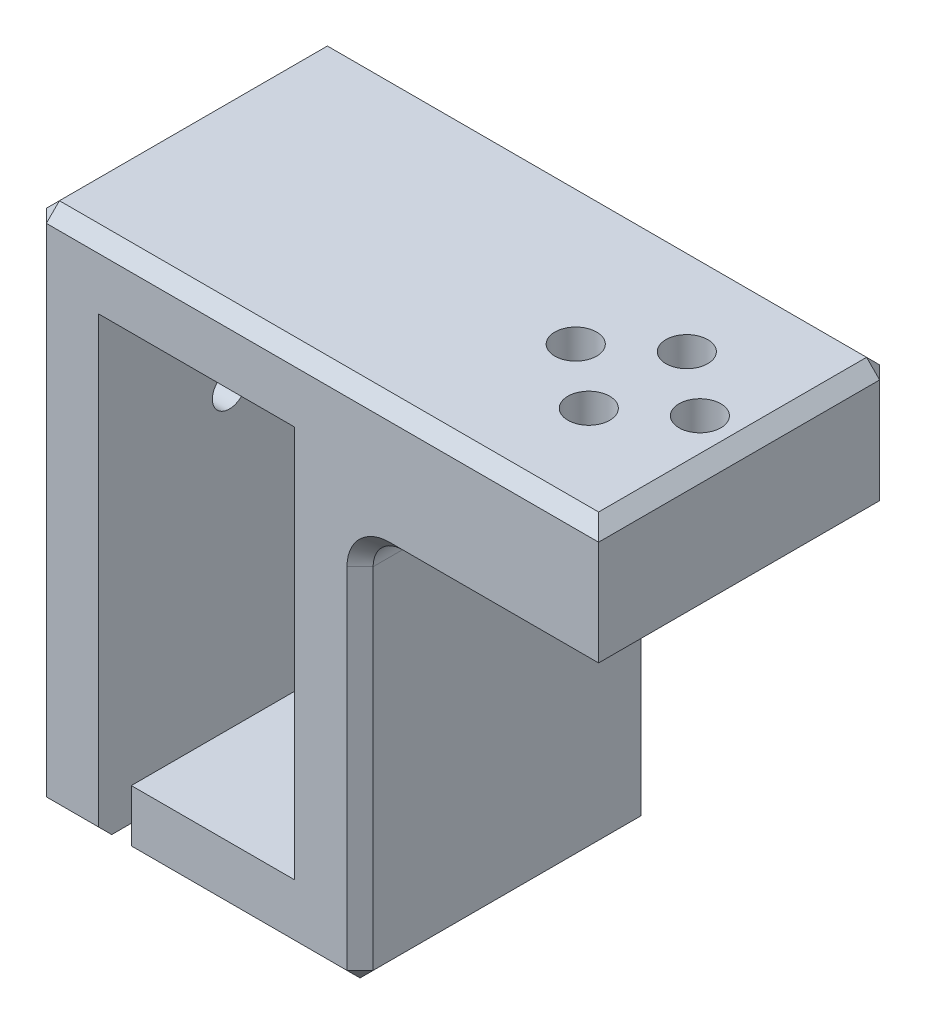
from build123d import *

# Parameters (mm, degrees)
BOSS_EXTRUDE1_DEPTH = 40
CUT_EXTRUDE1_START  = 10
SKETCH2_R           = 2.6
CUT_EXTRUDE1_DEPTH  = 113.46950766
SKETCH9_W           = 50
SKETCH9_H           = 80
BOSS_EXTRUDE2_DEPTH = 5
BOSS_EXTRUDE4_START = 80
SKETCH11_W          = 36.5
SKETCH11_H          = 45
SKETCH11_R          = 3.2
BOSS_EXTRUDE4_DEPTH = 20
CUT_EXTRUDE11_START = 60
SKETCH12_R          = 5.7
CUT_EXTRUDE11_DEPTH = 5
FILLET1_R           = 4.5


with BuildPart() as part:
    # Sketch1 → Boss-Extrude1 (new body)
    with BuildSketch(Plane.XY):
        Polygon((10, 0), (0, 0), (0, 80), (50, 80), (50, 0), (15, 0), (15, 10), (40, 10), (40, 70), (10, 70), align=None)
    extrude(amount=BOSS_EXTRUDE1_DEPTH)

    # Sketch2 → Cut-Extrude1 (cut, through all)
    with BuildSketch(Plane(origin=(0, 0, 0), x_dir=(0, 0, -1), z_dir=(1, 0, 0)).offset(CUT_EXTRUDE1_START)):
        with Locations(Location((-20, 50, 0), (0, 0, 270))):
            Circle(SKETCH2_R)
    extrude(amount=-CUT_EXTRUDE1_DEPTH, mode=Mode.SUBTRACT)

    # Sketch9 → Boss-Extrude2 (add)
    with BuildSketch(Plane.XY):
        with Locations((25, 40)):
            Rectangle(SKETCH9_W, SKETCH9_H)
    extrude(amount=-BOSS_EXTRUDE2_DEPTH)

    # Sketch11 → Boss-Extrude4 (add)
    with BuildSketch(Plane(origin=(0, 0, 0), x_dir=(1, 0, 0), z_dir=(0, 1, 0)).offset(BOSS_EXTRUDE4_START)):
        with Locations((68.25, -17.5)):
            Rectangle(SKETCH11_W, SKETCH11_H)
        with Locations(Location((60.5, -17.5, 0), (0, 0, 90))):
            Circle(SKETCH11_R, mode=Mode.SUBTRACT)
        with Locations(Location((70, -10, 0), (0, 0, 90))):
            Circle(SKETCH11_R, mode=Mode.SUBTRACT)
        with Locations(Location((79.5, -17.5, 0), (0, 0, 90))):
            Circle(SKETCH11_R, mode=Mode.SUBTRACT)
        with Locations(Location((70, -25, 0), (0, 0, 90))):
            Circle(SKETCH11_R, mode=Mode.SUBTRACT)
    extrude(amount=-BOSS_EXTRUDE4_DEPTH)

    # Sketch12 → Cut-Extrude11 (cut)
    with BuildSketch(Plane(origin=(0, 0, 0), x_dir=(1, 0, 0), z_dir=(0, 1, 0)).offset(CUT_EXTRUDE11_START)):
        with Locations(Location((70, -10, 0), (0, 0, 270))):
            Circle(SKETCH12_R)
        with Locations(Location((79.5, -17.5, 0), (0, 0, 270))):
            Circle(SKETCH12_R)
        with Locations(Location((70, -25, 0), (0, 0, 270))):
            Circle(SKETCH12_R)
        with Locations(Location((60.5, -17.5, 0), (0, 0, 270))):
            Circle(SKETCH12_R)
    extrude(amount=CUT_EXTRUDE11_DEPTH, mode=Mode.SUBTRACT)

    # Fillet1
    fillet1_edges = [part.edges().sort_by_distance(p)[0] for p in [
        (50, 60, 17.5),
    ]]
    fillet(fillet1_edges, radius=FILLET1_R)

    # Chamfer1
    # the kernel refuses this chamfer: 2 mm, written as the material it takes off along each edge
    with BuildSketch(Plane(origin=(1.333333333, 1.333333333, 38.666666667), x_dir=(0, -0.7071067811865475, -0.7071067811865475), z_dir=(-0.5773502691896347, -0.5773502691896213, 0.5773502691896212)), Plane(origin=(1.333333333, 78.666666667, -3.666666667), x_dir=(0, 0.7071067811865475, 0.7071067811865475), z_dir=(-0.5773502691896258, 0.5773502691896258, -0.5773502691896258)), Plane(origin=(48.666666667, 1.333333333, -3.666666667), x_dir=(-0.7071067811865475, 0, -0.7071067811865475), z_dir=(0.5773502691897349, -0.5773502691894069, -0.5773502691897356)), Plane(origin=(48.666666667, 1.333333333, 38.666666667), x_dir=(0.7071067811865464, 0, -0.7071067811865488), z_dir=(0.5773502691897359, -0.5773502691894074, 0.577350269189734)), Plane(origin=(85.166666667, 78.666666667, -3.666666667), x_dir=(0.7071067811865477, 0, 0.7071067811865474), z_dir=(0.5773502691896257, 0.5773502691896257, -0.577350269189626)), Plane(origin=(85.166666667, 61.333333333, -3.666666667), x_dir=(0.7071067811865475, 0.7071067811865475, 0), z_dir=(0.5773502691896256, -0.5773502691896257, -0.5773502691896258))) as chamfer1_piece_1:
        Polygon((-1.414213562, 0.816496581), (1.414213562, 0.816496581), (0, -1.632993162), align=None)
    extrude(amount=2.540341184, mode=Mode.SUBTRACT)
    with BuildSketch(Plane(origin=(1.333333333, 1.333333333, -3.666666667), x_dir=(0, -0.7071067811865558, 0.7071067811865391), z_dir=(-0.5773502691896303, -0.5773502691896167, -0.5773502691896303)), Plane(origin=(1.333333333, 78.666666667, 38.666666667), x_dir=(0, 0.7071067811865475, -0.7071067811865475), z_dir=(-0.5773502691896258, 0.5773502691896258, 0.5773502691896258))) as chamfer1_piece_2:
        Polygon((-1.414213562, -0.816496581), (1.414213562, -0.816496581), (0, 1.632993162), align=None)
    extrude(amount=2.540341184, mode=Mode.SUBTRACT)
    with BuildSketch(Plane(origin=(0, 0, 45.143365976), x_dir=(0.9996219169112961, -0.027495876610609604, 0), z_dir=(0, 0, -1)), Plane(origin=(86.5, 80, -10.143365976), x_dir=(0.027495876610589005, -0.9996219169112968, 0), z_dir=(0, 0, 1)), Plane(origin=(86.5, 60, -10.143365976), x_dir=(-0.9996219169112968, -0.02749587661058555, 0), z_dir=(0, 0, 1))) as chamfer1_piece_3:
        with BuildLine():
            Line((2.05734639, 0), (-0.11309431, -2.054235587))
            Line((-0.11309431, -2.054235587), (-0.153079186, -2.053135752))
            ThreePointArc((-0.153079186, -2.053135752), (-0.068258454, -1.026795659), (-0.039984877, 0.001099835))
            Line((-0.039984877, 0.001099835), (0.001099835, 0.039984877))
            ThreePointArc((0.001099835, 0.039984877), (1.028995329, 0.011711299), (2.058446225, 0.039984877))
            Line((2.058446225, 0.039984877), (2.05734639, 0))
        make_face()
    extrude(amount=55.286731952, mode=Mode.SUBTRACT)
    with BuildSketch(Plane(origin=(0, 80, 45.143365976), x_dir=(0.9996219169112968, 0.02749587661058908, 0), z_dir=(0, 0, -1)), Plane(origin=(50, 0, -10.143365976), x_dir=(0.027495876610585633, 0.9996219169112968, 0), z_dir=(0, 0, 1))) as chamfer1_piece_4:
        with BuildLine():
            Line((2.05734639, 0), (-0.11309431, 2.054235587))
            Line((-0.11309431, 2.054235587), (-0.153079186, 2.053135752))
            ThreePointArc((-0.153079186, 2.053135752), (-0.068258454, 1.026795659), (-0.039984877, -0.001099835))
            Line((-0.039984877, -0.001099835), (0.001099835, -0.039984877))
            ThreePointArc((0.001099835, -0.039984877), (1.028995329, -0.011711299), (2.058446225, -0.039984877))
            Line((2.058446225, -0.039984877), (2.05734639, 0))
        make_face()
    extrude(amount=55.286731952, mode=Mode.SUBTRACT)
    with BuildSketch(Plane(origin=(55.143365976, 0, 40), x_dir=(0, 0.9996219169112968, 0.02749587661058563), z_dir=(-1, 0, 0))) as chamfer1_piece_5:
        with BuildLine():
            Line((2.05734639, 0), (-0.11309431, 2.054235587))
            Line((-0.11309431, 2.054235587), (-0.153079186, 2.053135752))
            ThreePointArc((-0.153079186, 2.053135752), (-0.068258454, 1.026795659), (-0.039984877, -0.001099835))
            Line((-0.039984877, -0.001099835), (0.001099835, -0.039984877))
            ThreePointArc((0.001099835, -0.039984877), (1.028995329, -0.011711299), (2.058446225, -0.039984877))
            Line((2.058446225, -0.039984877), (2.05734639, 0))
        make_face()
    extrude(amount=45.286731952, mode=Mode.SUBTRACT)
    with BuildSketch(Plane(origin=(50, 55.5, 40), x_dir=(-0.9996219169112968, 0, 0.027495876610585647), z_dir=(0, -1, 0))) as chamfer1_piece_6:
        with BuildLine():
            Line((2.05734639, 0), (-0.11309431, 2.054235587))
            Line((-0.11309431, 2.054235587), (-0.153079186, 2.053135752))
            ThreePointArc((-0.153079186, 2.053135752), (-0.068258454, 1.026795659), (-0.039984877, -0.001099835))
            Line((-0.039984877, -0.001099835), (0.001099835, -0.039984877))
            ThreePointArc((0.001099835, -0.039984877), (1.028995329, -0.011711299), (2.058446225, -0.039984877))
            Line((2.058446225, -0.039984877), (2.05734639, 0))
        make_face()
    extrude(amount=60.643365976, mode=Mode.SUBTRACT)
    with BuildSketch(Plane(origin=(91.643365976, 80, 40), x_dir=(0, -0.9996219169112968, 0.02749587661058555), z_dir=(-1, 0, 0))) as chamfer1_piece_7:
        with BuildLine():
            Line((2.05734639, 0), (-0.11309431, -2.054235587))
            Line((-0.11309431, -2.054235587), (-0.153079186, -2.053135752))
            ThreePointArc((-0.153079186, -2.053135752), (-0.068258454, -1.026795659), (-0.039984877, 0.001099835))
            Line((-0.039984877, 0.001099835), (0.001099835, 0.039984877))
            ThreePointArc((0.001099835, 0.039984877), (1.028995329, 0.011711299), (2.058446225, 0.039984877))
            Line((2.058446225, 0.039984877), (2.05734639, 0))
        make_face()
    extrude(amount=96.786731952, mode=Mode.SUBTRACT)
    with BuildSketch(Plane(origin=(50, -5.143365976, -5), x_dir=(0.02749587661058563, 0, 0.9996219169112968), z_dir=(0, 1, 0))) as chamfer1_piece_8:
        with BuildLine():
            Line((2.05734639, 0), (-0.11309431, -2.054235587))
            Line((-0.11309431, -2.054235587), (-0.153079186, -2.053135752))
            ThreePointArc((-0.153079186, -2.053135752), (-0.068258454, -1.026795659), (-0.039984877, 0.001099835))
            Line((-0.039984877, 0.001099835), (0.001099835, 0.039984877))
            ThreePointArc((0.001099835, 0.039984877), (1.028995329, 0.011711299), (2.058446225, 0.039984877))
            Line((2.058446225, 0.039984877), (2.05734639, 0))
        make_face()
    extrude(amount=60.643365976, mode=Mode.SUBTRACT)
    with BuildSketch(Plane(origin=(-5.143365976, 0, -5), x_dir=(0, -0.027495876610586372, 0.9996219169112968), z_dir=(1, 0, 0))) as chamfer1_piece_9:
        with BuildLine():
            Line((2.05734639, 0), (-0.11309431, -2.054235587))
            Line((-0.11309431, -2.054235587), (-0.153079186, -2.053135752))
            ThreePointArc((-0.153079186, -2.053135752), (-0.068258454, -1.026795659), (-0.039984877, 0.001099835))
            Line((-0.039984877, 0.001099835), (0.001099835, 0.039984877))
            ThreePointArc((0.001099835, 0.039984877), (1.028995329, 0.011711299), (2.058446225, 0.039984877))
            Line((2.058446225, 0.039984877), (2.05734639, 0))
        make_face()
    extrude(amount=60.286731952, mode=Mode.SUBTRACT)
    with BuildSketch(Plane(origin=(0, 85.143365976, -5), x_dir=(-0.027495876610586372, 0, 0.9996219169112968), z_dir=(0, -1, 0))) as chamfer1_piece_10:
        with BuildLine():
            Line((2.05734639, 0), (-0.11309431, -2.054235587))
            Line((-0.11309431, -2.054235587), (-0.153079186, -2.053135752))
            ThreePointArc((-0.153079186, -2.053135752), (-0.068258454, -1.026795659), (-0.039984877, 0.001099835))
            Line((-0.039984877, 0.001099835), (0.001099835, 0.039984877))
            ThreePointArc((0.001099835, 0.039984877), (1.028995329, 0.011711299), (2.058446225, 0.039984877))
            Line((2.058446225, 0.039984877), (2.05734639, 0))
        make_face()
    extrude(amount=90.286731952, mode=Mode.SUBTRACT)
    with BuildSketch(Plane(origin=(0, -5.143365976, 40), x_dir=(0.9996219169112968, 0, 0.02749587661058563), z_dir=(0, 1, 0))) as chamfer1_piece_11:
        with BuildLine():
            Line((2.05734639, 0), (-0.11309431, 2.054235587))
            Line((-0.11309431, 2.054235587), (-0.153079186, 2.053135752))
            ThreePointArc((-0.153079186, 2.053135752), (-0.068258454, 1.026795659), (-0.039984877, -0.001099835))
            Line((-0.039984877, -0.001099835), (0.001099835, -0.039984877))
            ThreePointArc((0.001099835, -0.039984877), (1.028995329, -0.011711299), (2.058446225, -0.039984877))
            Line((2.058446225, -0.039984877), (2.05734639, 0))
        make_face()
    extrude(amount=90.286731952, mode=Mode.SUBTRACT)
    with BuildSketch(Plane(origin=(-5.143365976, 80, -5), x_dir=(0, 0.02749587661058908, 0.9996219169112968), z_dir=(1, 0, 0))) as chamfer1_piece_12:
        with BuildLine():
            Line((2.05734639, 0), (-0.11309431, 2.054235587))
            Line((-0.11309431, 2.054235587), (-0.153079186, 2.053135752))
            ThreePointArc((-0.153079186, 2.053135752), (-0.068258454, 1.026795659), (-0.039984877, -0.001099835))
            Line((-0.039984877, -0.001099835), (0.001099835, -0.039984877))
            ThreePointArc((0.001099835, -0.039984877), (1.028995329, -0.011711299), (2.058446225, -0.039984877))
            Line((2.058446225, -0.039984877), (2.05734639, 0))
        make_face()
    extrude(amount=96.786731952, mode=Mode.SUBTRACT)
    with BuildSketch(Plane(origin=(15.143365976, 0, 40), x_dir=(2.3568108242796768e-14, 0.9996219169112968, 0.027495876610585623), z_dir=(-1, 0, 0))) as chamfer1_piece_13:
        with BuildLine():
            Line((2.05734639, 0), (-0.11309431, 2.054235587))
            Line((-0.11309431, 2.054235587), (-0.153079186, 2.053135752))
            ThreePointArc((-0.153079186, 2.053135752), (-0.068258454, 1.026795659), (-0.039984877, -0.001099835))
            Line((-0.039984877, -0.001099835), (0.001099835, -0.039984877))
            ThreePointArc((0.001099835, -0.039984877), (1.028995329, -0.011711299), (2.058446225, -0.039984877))
            Line((2.058446225, -0.039984877), (2.05734639, 0))
        make_face()
    extrude(amount=20.286731952, mode=Mode.SUBTRACT)
    with BuildSketch(Plane(origin=(54.5, 60, -5), x_dir=(0, -0.027495876610585616, 0.9996219169112968), z_dir=(1, 0, 0))) as chamfer1_piece_14:
        with BuildLine():
            Line((2.05734639, 0), (-0.11309431, -2.054235587))
            Line((-0.11309431, -2.054235587), (-0.153079186, -2.053135752))
            ThreePointArc((-0.153079186, -2.053135752), (-0.068258454, -1.026795659), (-0.039984877, 0.001099835))
            Line((-0.039984877, 0.001099835), (0.001099835, 0.039984877))
            ThreePointArc((0.001099835, 0.039984877), (1.028995329, 0.011711299), (2.058446225, 0.039984877))
            Line((2.058446225, 0.039984877), (2.05734639, 0))
        make_face()
    extrude(amount=37.143365976, mode=Mode.SUBTRACT)
    with BuildSketch(Plane(origin=(86.5, 85.143365976, -5), x_dir=(0.02749587661058908, 0, 0.9996219169112968), z_dir=(0, -1, 0))) as chamfer1_piece_15:
        with BuildLine():
            Line((2.05734639, 0), (-0.11309431, 2.054235587))
            Line((-0.11309431, 2.054235587), (-0.153079186, 2.053135752))
            ThreePointArc((-0.153079186, 2.053135752), (-0.068258454, 1.026795659), (-0.039984877, -0.001099835))
            Line((-0.039984877, -0.001099835), (0.001099835, -0.039984877))
            ThreePointArc((0.001099835, -0.039984877), (1.028995329, -0.011711299), (2.058446225, -0.039984877))
            Line((2.058446225, -0.039984877), (2.05734639, 0))
        make_face()
    extrude(amount=30.286731952, mode=Mode.SUBTRACT)
    with BuildSketch(Plane(origin=(91.643365976, 60, 40), x_dir=(0, 0.9996219169112968, 0.027495876610585647), z_dir=(-1, 0, 0))) as chamfer1_piece_16:
        with BuildLine():
            Line((2.05734639, 0), (-0.11309431, 2.054235587))
            Line((-0.11309431, 2.054235587), (-0.153079186, 2.053135752))
            ThreePointArc((-0.153079186, 2.053135752), (-0.068258454, 1.026795659), (-0.039984877, -0.001099835))
            Line((-0.039984877, -0.001099835), (0.001099835, -0.039984877))
            ThreePointArc((0.001099835, -0.039984877), (1.028995329, -0.011711299), (2.058446225, -0.039984877))
            Line((2.058446225, -0.039984877), (2.05734639, 0))
        make_face()
    extrude(amount=37.143365976, mode=Mode.SUBTRACT)
    with BuildSketch(Plane(origin=(54.5, 55.5, 40), x_dir=(-1, 0, 0), z_dir=(0, -1, 0))) as chamfer1_piece_17:
        with BuildLine():
            Line((6.556568542, -0.056568542), (4.443431458, 2.056568542))
            Line((4.443431458, 2.056568542), (4.403431458, 2.056568542))
            ThreePointArc((4.403431458, 2.056568542), (4.46, 1.028284271), (4.46, 0))
            Line((4.46, 0), (4.5, -0.04))
            ThreePointArc((4.5, -0.04), (5.528284271, -0.04), (6.556568542, -0.096568542))
            Line((6.556568542, -0.096568542), (6.556568542, -0.056568542))
        make_face()
    revolve(axis=Axis((54.5, 55.5, 40), (0, 0, -1)), revolution_arc=90, mode=Mode.SUBTRACT)
    with BuildSketch(Plane(origin=(54.5, 55.5, -5), x_dir=(-1, 0, 0), z_dir=(0, -1, 0))) as chamfer1_piece_18:
        with BuildLine():
            Line((4.443431458, -2.056568542), (6.556568542, 0.056568542))
            Line((6.556568542, 0.056568542), (6.556568542, 0.096568542))
            ThreePointArc((6.556568542, 0.096568542), (5.528284271, 0.04), (4.5, 0.04))
            Line((4.5, 0.04), (4.46, 0))
            ThreePointArc((4.46, 0), (4.46, -1.028284271), (4.403431458, -2.056568542))
            Line((4.403431458, -2.056568542), (4.443431458, -2.056568542))
        make_face()
    revolve(axis=Axis((54.5, 55.5, -5), (0, 0, -1)), revolution_arc=90, mode=Mode.SUBTRACT)


solid = part.part
